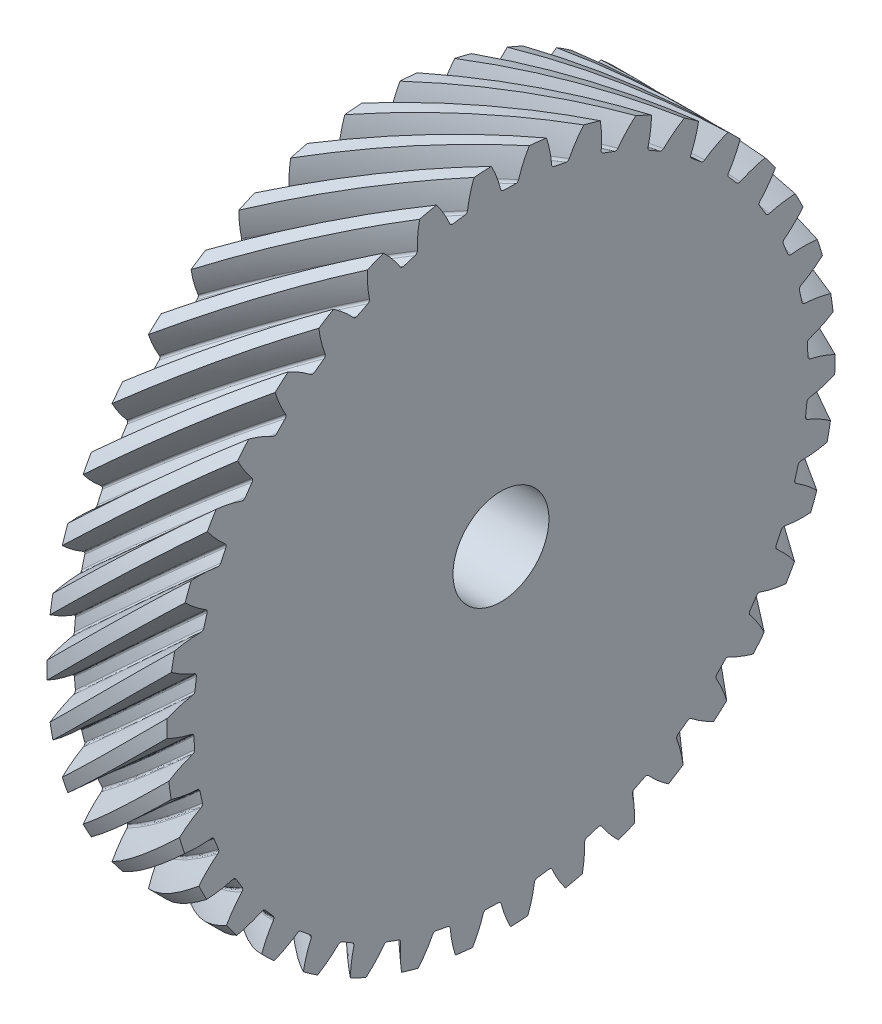
from build123d import *

# Parameters (mm, degrees)
BASPROSKE_W            = 25
BASPROSKE_H            = 69.675144213
TOOTHCUTLH_PITCH       = 437.781842393
TOOTHCUTLH_HEIGHT      = 25
TOOTHCUTLH_RADIUS      = 69.675144213
TOOTHCUTLH_START_ANGLE = -90
TEETHCUTSLH_COUNT      = 38
TEETHCUTSLH_ANGLE      = 350.526315789
BORSKE_R               = 10
BORE_DEPTH             = 62.5000025


with BuildPart() as part:
    # BasProSke → Base-Revolve (revolve)
    with BuildSketch(Plane(origin=(0, 0, 0), x_dir=(1, 0, 0), z_dir=(0, 1, 0)), mode=Mode.PRIVATE) as base_revolve_sk:
        with Locations((12.5, 34.837572107)):
            Rectangle(BASPROSKE_W, BASPROSKE_H)
    revolve(base_revolve_sk.sketch.rotate(Axis((-10, 0, 0), (1, 0, 0)), 180), axis=Axis((-10, 0, 0), (1, 0, 0)))

    # ToothCutLH: sweep along a helix
    with BuildLine() as toothcutlh_path:
        add(Helix(TOOTHCUTLH_PITCH, TOOTHCUTLH_HEIGHT, TOOTHCUTLH_RADIUS, center=(0, 0, 0), direction=(1, 0, 0), lefthand=True, mode=Mode.PRIVATE).rotate(Axis((0, 0, 0), (1, 0, 0)), TOOTHCUTLH_START_ANGLE))
    # TooCutSkeRH<3> → ToothCutLH (sweep, cut)
    with BuildSketch(Plane(origin=(0, 0, 0), x_dir=(0, 0, -1), z_dir=(1, 0, 0))):
        with BuildLine():
            ThreePointArc((1.251147104, 64.037923175), (0, 64.050144213), (-1.251147104, 64.037923175))
            ThreePointArc((-1.251147104, 64.037923175), (-1.636253652, 64.160974), (-1.865835421, 64.493751358))
            ThreePointArc((-1.865835421, 64.493751358), (-3.242203394, 68.173651921), (-5.206405021, 71.576293381))
            ThreePointArc((-5.206405021, 71.576293381), (0, 71.765398539), (5.206405021, 71.576293381))
            ThreePointArc((5.206405021, 71.576293381), (3.242203394, 68.173651921), (1.865835421, 64.493751358))
            ThreePointArc((1.865835421, 64.493751358), (1.636253652, 64.160974), (1.251147104, 64.037923175))
        make_face()
    toothcutlh = sweep(path=toothcutlh_path.line, is_frenet=True, mode=Mode.SUBTRACT)

    # TeethCutsLH: ToothCutLH ×38 about axis
    teethcutslh_axis = Axis((-10, 0, 0), (1, 0, 0))
    for i in range(1, TEETHCUTSLH_COUNT):
        add(toothcutlh.rotate(teethcutslh_axis, i * TEETHCUTSLH_ANGLE / (TEETHCUTSLH_COUNT - 1)), mode=Mode.SUBTRACT)

    # BorSke → Bore (cut, symmetric)
    with BuildSketch(Plane(origin=(0, 0, 0), x_dir=(0, 0, -1), z_dir=(1, 0, 0))):
        with Locations(Location((0, 0, 0), (0, 0, 180))):
            Circle(BORSKE_R)
    extrude(amount=BORE_DEPTH, both=True, mode=Mode.SUBTRACT)


solid = part.part
